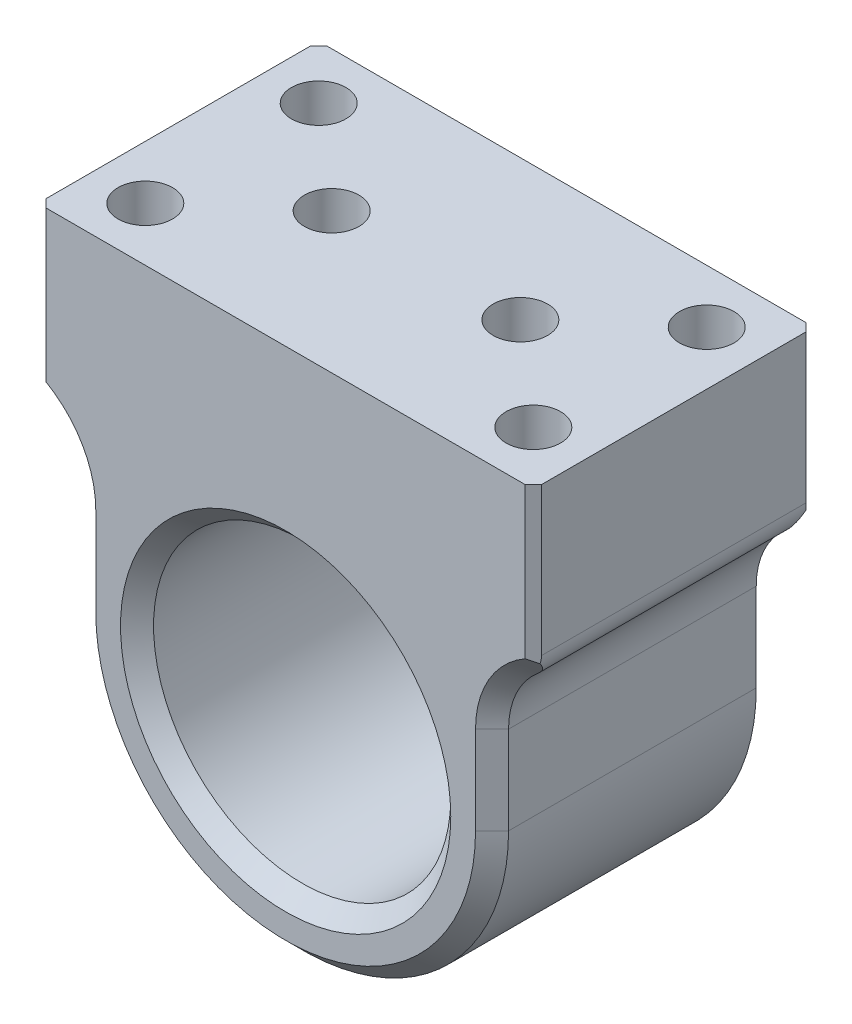
from build123d import *

# Parameters (mm, degrees)
SKETCH_1_R             = 9
EXTRUDE_2_DEPTH        = 17
FILLET_7_R             = 5
CHAMFER_3_SIZE         = 1
CHAMFER_4_SIZE         = 1
CHAMFER_5_SIZE         = 0.5
FILLET_9_R             = 2
HOLE_WIZARD_M4_3_D     = 3.3
HOLE_WIZARD_M4_3_DEPTH = 10.1
HOLE_WIZARD_M4_3_TIP   = 0.991420021
HOLE_WIZARD_M4_4_D     = 3.3
HOLE_WIZARD_M4_4_DEPTH = 8
HOLE_WIZARD_M4_4_TIP   = 0.991420021


with BuildPart() as part:
    # 草图1 → 凸台-拉伸2 (new body)
    with BuildSketch(Plane.XY):
        with BuildLine():
            Line((-16.527519938, 348.633233256), (-16.527519938, 338.633233256))
            Line((-16.527519938, 338.633233256), (-19.027519938, 338.633233256))
            Line((-19.027519938, 338.633233256), (-19.027519938, 328.968626967))
            ThreePointArc((-19.027519938, 328.968626967), (-31.527519938, 316.468626967), (-44.027519938, 328.968626967))
            Line((-44.027519938, 328.968626967), (-44.027519938, 338.633233256))
            Line((-44.027519938, 338.633233256), (-46.527519938, 338.633233256))
            Line((-46.527519938, 338.633233256), (-46.527519938, 348.633233256))
            Line((-46.527519938, 348.633233256), (-16.527519938, 348.633233256))
        make_face()
        with Locations((-31.527519938, 328.968626967)):
            Circle(SKETCH_1_R, mode=Mode.SUBTRACT)
    extrude(amount=EXTRUDE_2_DEPTH)

    # 圆角7
    # the kernel refuses this fillet: 5 mm, written as the material it adds along each edge
    with BuildSketch(Plane(origin=(-19.027519938, 338.633233256, 0), x_dir=(1, 0, 0), z_dir=(0, 0, 1))) as fillet_7_piece_1:
        with BuildLine():
            CenterArc((5, -4.330127019), FILLET_7_R, 120, 60)
            Line((0, -4.330127019), (-0.1, -4.330127019))
            Line((-0.1, -4.330127019), (-0.1, 0))
            Line((-0.1, 0), (0, 0.1))
            ThreePointArc((0, 0.1), (1.25, 0.1), (2.45, 0.08660254))
            Line((2.45, 0.08660254), (2.5, 0))
        make_face()
    extrude(amount=17)
    with BuildSketch(Plane(origin=(-44.027519938, 338.633233256, 0), x_dir=(0, -1, 0), z_dir=(0, 0, 1))) as fillet_7_piece_2:
        with BuildLine():
            CenterArc((4.330127019, -5), FILLET_7_R, 90, 60)
            Line((0, -2.5), (-0.08660254, -2.45))
            ThreePointArc((-0.08660254, -2.45), (-0.1, -1.25), (-0.1, 0))
            Line((-0.1, 0), (0, 0.1))
            Line((0, 0.1), (4.330127019, 0.1))
            Line((4.330127019, 0.1), (4.330127019, 0))
        make_face()
    extrude(amount=17)

    # 倒角3
    chamfer_3_edges = [part.edges().sort_by_distance(p)[0] for p in [
        (-31.527519938, 316.468626967, 17),
        (-19.027519938, 331.635866602, 17),
        (-44.027519938, 331.635866602, 17),
        (-18.357646957, 336.803106237, 17),
        (-44.697392919, 336.803106237, 17),
    ]]
    chamfer(chamfer_3_edges, length=CHAMFER_3_SIZE)

    # 倒角4
    chamfer_4_edges = [part.edges().sort_by_distance(p)[0] for p in [
        (-19.027519938, 331.635866602, 0),
        (-31.527519938, 316.468626967, 0),
        (-40.527519938, 328.968626967, 0),
        (-40.527519938, 328.968626967, 17),
        (-44.027519938, 331.635866602, 0),
        (-18.357646957, 336.803106237, 0),
        (-44.697392919, 336.803106237, 0),
    ]]
    chamfer(chamfer_4_edges, length=CHAMFER_4_SIZE)

    # 倒角5
    chamfer_5_edges = [part.edges().sort_by_distance(p)[0] for p in [
        (-16.527519938, 344.195347776, 0),
        (-16.527519938, 344.195347776, 17),
        (-46.527519938, 344.195347776, 0),
        (-46.527519938, 344.195347776, 17),
    ]]
    chamfer(chamfer_5_edges, length=CHAMFER_5_SIZE)

    # 圆角9
    fillet_9_edges = [part.edges().sort_by_distance(p)[0] for p in [
        (-16.527519938, 338.633233256, 8.5),
        (-46.527519938, 338.633233256, 8.5),
    ]]
    fillet(fillet_9_edges, radius=FILLET_9_R)

    # M4 螺纹孔3
    with Locations(Plane(origin=(0, 348.633233256, 0), x_dir=(1, 0, 0), z_dir=(0, 1, 0))):
        with Locations((-19.777519938, -13.75), (-43.277519938, -13.75), (-43.277519938, -3.248268424), (-19.777519938, -3.248268424)):
            Hole(HOLE_WIZARD_M4_3_D / 2, depth=HOLE_WIZARD_M4_3_DEPTH)
            with Locations((0, 0, -(HOLE_WIZARD_M4_3_DEPTH + HOLE_WIZARD_M4_3_TIP / 2))):  # 118° drill point
                Cone(0, HOLE_WIZARD_M4_3_D / 2, HOLE_WIZARD_M4_3_TIP, mode=Mode.SUBTRACT)

    # M4 螺纹孔4
    with Locations(Plane(origin=(0, 348.633233256, 0), x_dir=(1, 0, 0), z_dir=(0, 1, 0))):
        with Locations((-37.241924816, -8.499134212), (-25.81311506, -8.499134212)):
            Hole(HOLE_WIZARD_M4_4_D / 2, depth=HOLE_WIZARD_M4_4_DEPTH)
            with Locations((0, 0, -(HOLE_WIZARD_M4_4_DEPTH + HOLE_WIZARD_M4_4_TIP / 2))):  # 118° drill point
                Cone(0, HOLE_WIZARD_M4_4_D / 2, HOLE_WIZARD_M4_4_TIP, mode=Mode.SUBTRACT)


solid = part.part
